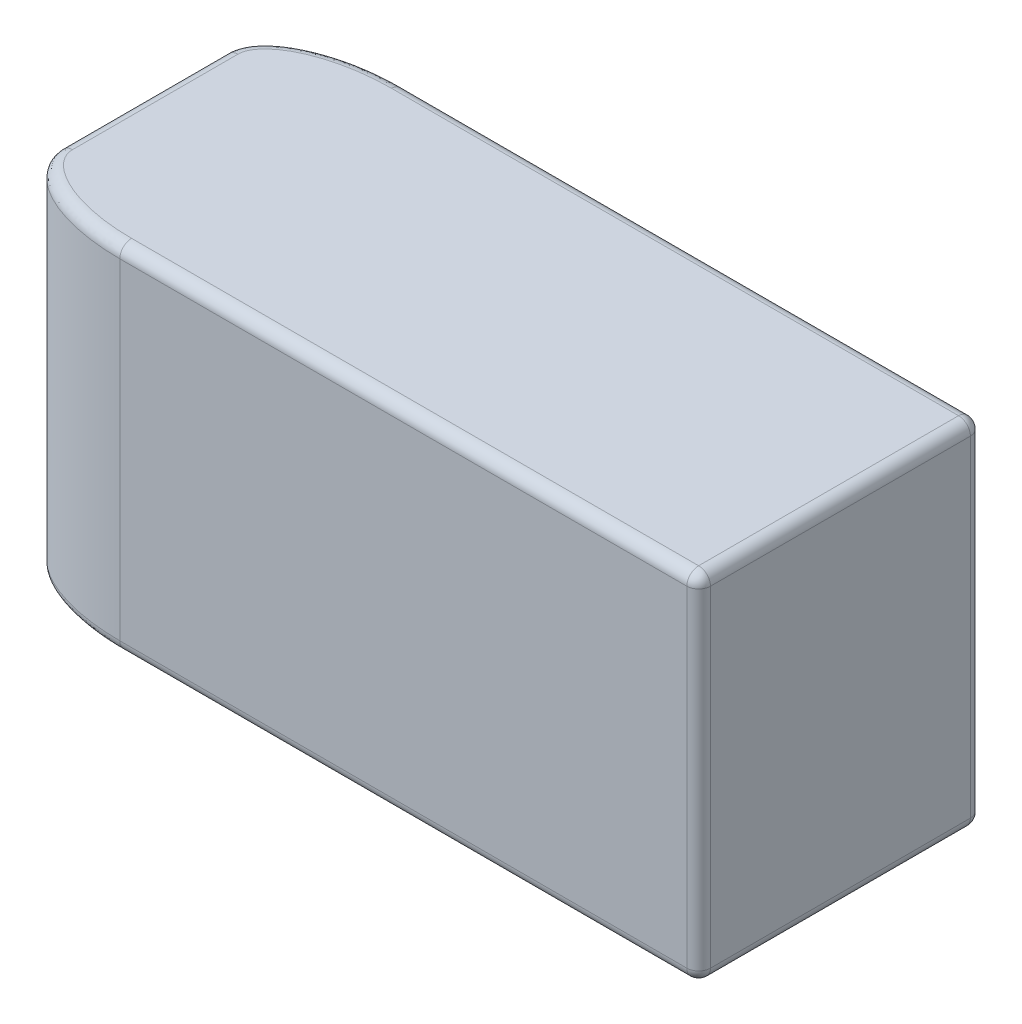
from build123d import *

# Parameters (mm, degrees)
SKETCH1_W           = 59
SKETCH1_H           = 24
BOSS_EXTRUDE1_DEPTH = 15
FILLET1_R           = 1
FILLET2_SIZE        = 5
FILLET2_SIZE_2      = 10
FILLET3_R           = 1


with BuildPart() as part:
    # Sketch1 → Boss-Extrude1 (new, symmetric)
    with BuildSketch(Plane(origin=(0, 0, 0), x_dir=(1, 0, 0), z_dir=(0, 1, 0))):
        Rectangle(SKETCH1_W, SKETCH1_H)
    extrude(amount=BOSS_EXTRUDE1_DEPTH, both=True)

    # Fillet1
    fillet1_edges = [part.edges().sort_by_distance(p)[0] for p in [
        (29.5, 0, 12),
        (29.5, 0, -12),
    ]]
    fillet(fillet1_edges, radius=FILLET1_R)

    # Fillet2
    # an asymmetric fillet: 10, 5 mm, written as the material it takes off along each edge
    with BuildSketch(Plane(origin=(-29.5, 40, -12), x_dir=(0, 0, 1), z_dir=(0, -1, 0))) as fillet2_piece_1:
        with BuildLine():
            Bezier((FILLET2_SIZE, 0), (0, 0), (0, -FILLET2_SIZE_2), weights=[1, 0.707106781, 1])
            Line((0, -FILLET2_SIZE_2), (0, 0))
            Line((0, 0), (FILLET2_SIZE, 0))
        make_face()
    extrude(amount=80, mode=Mode.SUBTRACT)
    with BuildSketch(Plane(origin=(-29.5, 40, 12), x_dir=(1, 0, 0), z_dir=(0, -1, 0))) as fillet2_piece_2:
        with BuildLine():
            Bezier((FILLET2_SIZE_2, 0), (0, 0), (0, -FILLET2_SIZE), weights=[1, 0.707106781, 1])
            Line((0, -FILLET2_SIZE), (0, 0))
            Line((0, 0), (FILLET2_SIZE_2, 0))
        make_face()
    extrude(amount=80, mode=Mode.SUBTRACT)

    # Fillet3
    fillet3_edges = [part.edges().sort_by_distance(p)[0] for p in [
        (-25.444718917, -15, 11.02058196),
        (-29.5, -15, 0),
        (-25.444718915, -15, -11.020581957),
        (4.5, -15, -12),
        (29.207106781, -15, -11.707106781),
        (29.5, -15, 0),
        (29.207106781, -15, 11.707106781),
        (-25.444718917, 15, 11.02058196),
        (-29.5, 15, 0),
        (-25.444718915, 15, -11.020581957),
        (4.5, 15, -12),
        (29.207106781, 15, -11.707106781),
        (29.5, 15, 0),
        (29.207106781, 15, 11.707106781),
        (4.5, -15, 12),
        (4.5, 15, 12),
    ]]
    fillet(fillet3_edges, radius=FILLET3_R)


solid = part.part
